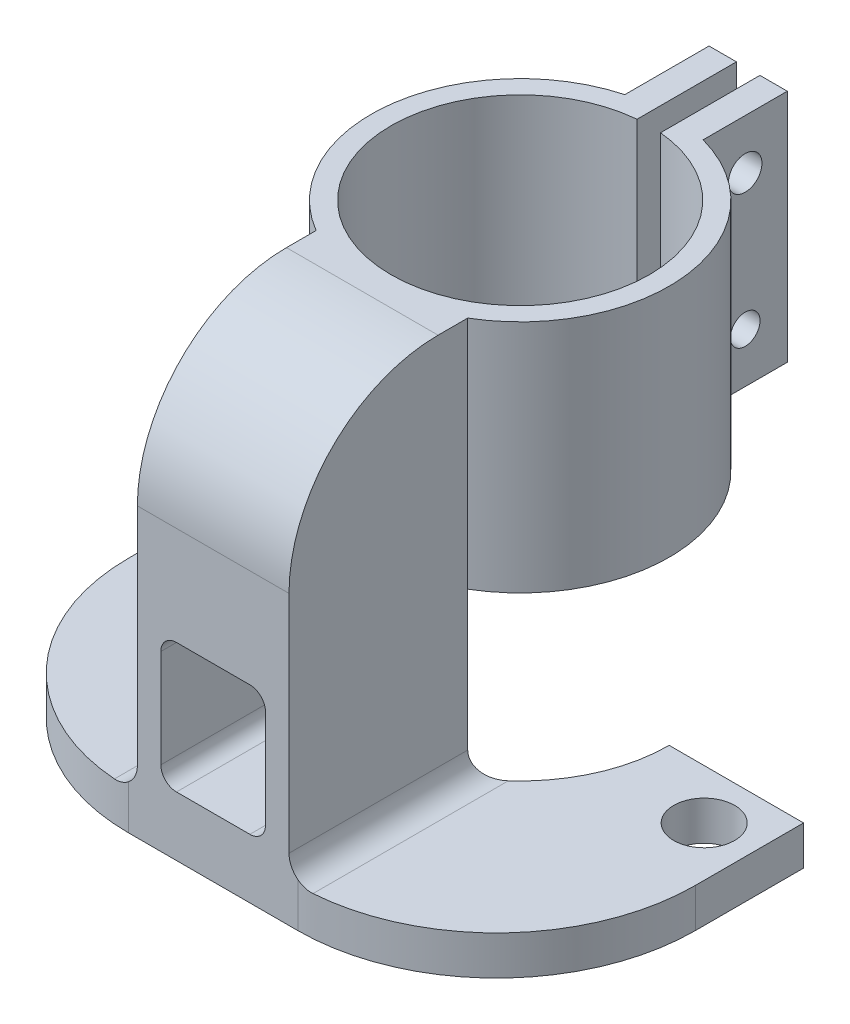
from build123d import *

# Parameters (mm, degrees)
CLAMP_DEPTH             = 30
TOWER_START             = -50.8
TOWER_DEPTH             = 50.8
BASE_START              = 5
SKETCH3_R               = 4.049819506230844
SKETCH3_R_2             = 3.891816963996009
BASE_DEPTH              = 5
FILLET1_R               = 25.4
FILLET2_R               = 19.05
FILLET3_R               = 3
CLAMP_HOLES_DEPTH       = 65.31922708365349
CLAMP_HOLES_DEPTH_BACK  = 65.31922708365349
SKETCH4_R               = 2.1409974318018494
SKETCH4_R_2             = 1.8937223504099991
MOTOR_WIRE_CUTOUT_DEPTH = 83.96971831093074


with BuildPart() as part:
    # Sketch1 → Clamp (new body)
    with BuildSketch(Plane(origin=(0, 0, 0), x_dir=(1, 0, 0), z_dir=(0, 1, 0))):
        with BuildLine():
            Line((-5.000000000000001, 18.371760939006364), (-5.0000000000000036, 29.131676725154982))
            Line((-5.0000000000000036, 29.131676725154982), (-1.5000000000000024, 29.131676725154982))
            Line((-1.5000000000000024, 29.131676725154982), (-1.5000000000000027, 16.43167672515498))
            ThreePointArc((-1.5000000000000027, 16.43167672515498), (-3.03e-15, -16.499999999999996), (1.4999999999999971, 16.43167672515498))
            Line((1.4999999999999971, 16.43167672515498), (1.4999999999999971, 29.131676725154982))
            Line((1.4999999999999971, 29.131676725154982), (4.9999999999999964, 29.13167672515498))
            Line((4.9999999999999964, 29.13167672515498), (4.999999999999999, 18.371760939006364))
            ThreePointArc((4.999999999999999, 18.371760939006364), (-3.5e-15, -19.04), (-5.000000000000001, 18.371760939006364))
        make_face()
    extrude(amount=CLAMP_DEPTH)

    # Sketch2 → Tower (add)
    with BuildSketch(Plane(origin=(0, 30, 0), x_dir=(1, 0, 0), z_dir=(0, 1, 0)).offset(TOWER_START)):
        with BuildLine():
            Line((-9.686952112933966, -16.391600250180705), (-9.686952112933966, -39.22630541330526))
            Line((-9.686952112933966, -39.22630541330526), (9.686952112933966, -39.22630541330526))
            Line((9.686952112933966, -39.22630541330526), (9.686952112933966, -16.391600250180705))
            ThreePointArc((9.68695211293397, -16.391600250180712), (1.78e-15, -19.04), (-9.686952112933957, -16.391600250180705))
        make_face()
    extrude(amount=TOWER_DEPTH)

    # Sketch3 → Base (add)
    with BuildSketch(Plane.XZ.offset(20.8).offset(BASE_START)):
        with BuildLine():
            Line((-36.20994928622734, 39.22630541330526), (36.20994928622734, 39.22630541330527))
            Line((36.20994928622734, 39.22630541330527), (36.20994928622735, -2.8e-16))
            Line((36.20994928622735, -2.8e-16), (19.04, -2.37e-15))
            ThreePointArc((19.04, -2.37e-15), (16.53724838403086, 9.436154719209974), (9.686952112933966, 16.391600250180705))
            ThreePointArc((9.686952112933966, 16.391600250180705), (1.17e-15, 19.04), (-9.686952112933966, 16.391600250180705))
            ThreePointArc((-9.686952112933966, 16.391600250180705), (-16.537248384030864, 9.43615471920997), (-19.04, -7.01e-15))
            Line((-19.04, -7.01e-15), (-36.20994928622734, -9.11e-15))
            Line((-36.20994928622734, -9.11e-15), (-36.20994928622734, 39.22630541330526))
        make_face()
        with Locations((-29.859949286227337, 6.3499999999999925)):
            Circle(SKETCH3_R, mode=Mode.SUBTRACT)
        with Locations((29.859949286227348, 6.349999999999994)):
            Circle(SKETCH3_R_2, mode=Mode.SUBTRACT)
    extrude(amount=-BASE_DEPTH)

    # Fillet1
    fillet1_edges = [part.edges().sort_by_distance(p)[0] for p in [
        (36.20994928622734, -23.3, 39.22630541330527),
        (-36.20994928622734, -23.3, 39.22630541330526),
    ]]
    fillet(fillet1_edges, radius=FILLET1_R)

    # Fillet2
    fillet2_edges = [part.edges().sort_by_distance(p)[0] for p in [
        (0, 30, 39.22630541330526),
    ]]
    fillet(fillet2_edges, radius=FILLET2_R)

    # Fillet3
    fillet3_edges = [part.edges().sort_by_distance(p)[0] for p in [
        (9.686952112933966, -20.799999999999997, 27.808952831742985),
        (-9.686952112933966, -20.799999999999997, 27.808952831742985),
    ]]
    fillet(fillet3_edges, radius=FILLET3_R)

    # Sketch4 → Clamp Holes (cut, two sides: drawn at the far end of the back side and taken through both)
    with BuildSketch(Plane.ZY.offset(4.9999999999999964).offset(-CLAMP_HOLES_DEPTH_BACK)):
        with Locations((-23.751718832080673, 23.65)):
            Circle(SKETCH4_R)
        with Locations((-23.75171883208067, 6.35)):
            Circle(SKETCH4_R_2)
    extrude(amount=CLAMP_HOLES_DEPTH + CLAMP_HOLES_DEPTH_BACK, mode=Mode.SUBTRACT)

    # Sketch5 → Motor Wire Cutout (cut, through all)
    with BuildSketch(Plane.XY.offset(39.22630541330526)):
        with BuildLine():
            Line((-4.686952112933952, -18.20707285153249), (4.686952112933964, -18.20707285153249))
            ThreePointArc((4.686952112933964, -18.20707285153249), (6.101165675307072, -17.621286413905587), (6.686952112933978, -16.207072851532477))
            Line((6.686952112933978, -16.207072851532477), (6.686952112933978, -3.6633290972563026))
            ThreePointArc((6.686952112933978, -3.6633290972563026), (6.101165675307072, -2.2491155348831935), (4.686952112933963, -1.6633290972562886))
            Line((4.686952112933963, -1.6633290972562886), (-4.686952112933953, -1.6633290972562886))
            ThreePointArc((-4.686952112933953, -1.6633290972562886), (-6.101165675307062, -2.2491155348831935), (-6.686952112933966, -3.6633290972563026))
            Line((-6.686952112933966, -3.6633290972563026), (-6.686952112933966, -16.207072851532477))
            ThreePointArc((-6.686952112933966, -16.207072851532477), (-6.10116567530706, -17.621286413905587), (-4.686952112933952, -18.20707285153249))
        make_face()
    extrude(amount=-MOTOR_WIRE_CUTOUT_DEPTH, mode=Mode.SUBTRACT)


solid = part.part
